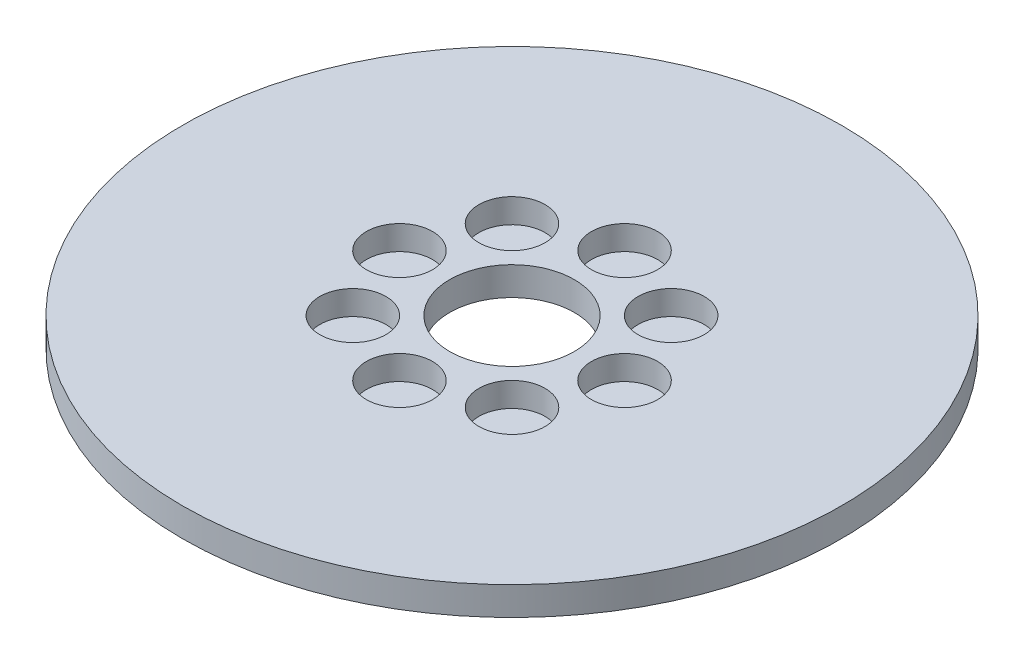
from build123d import *

# Parameters (mm, degrees)
SKETCH1_R           = 92.5
BOSS_EXTRUDE1_DEPTH = 8
SKETCH2_R           = 17.5
CUT_EXTRUDE1_DEPTH  = 132.059146953
SKETCH3_R           = 9.289288959
CUT_EXTRUDE2_DEPTH  = 6.823425341
CIRPATTERN1_COUNT   = 8


with BuildPart() as part:
    # Sketch1 → Boss-Extrude1 (new body)
    with BuildSketch(Plane(origin=(0, 0, 0), x_dir=(1, 0, 0), z_dir=(0, 1, 0))):
        Circle(SKETCH1_R)
    extrude(amount=BOSS_EXTRUDE1_DEPTH)

    # Sketch2 → Cut-Extrude1 (cut, through all)
    with BuildSketch(Plane(origin=(0, 0, 0), x_dir=(1, 0, 0), z_dir=(0, 1, 0))):
        Circle(SKETCH2_R)
    extrude(amount=CUT_EXTRUDE1_DEPTH, mode=Mode.SUBTRACT)

    # Sketch3 → Cut-Extrude2 (cut)
    with BuildSketch(Plane(origin=(0, 8, 0), x_dir=(1, 0, 0), z_dir=(0, 1, 0))):
        with Locations((-31.58667417, 0)):
            Circle(SKETCH3_R)
    cut_extrude2 = extrude(amount=-CUT_EXTRUDE2_DEPTH, mode=Mode.SUBTRACT)

    # CirPattern1: Cut-Extrude2 ×8 about axis
    cirpattern1_axis = Axis((0, 0, 0), (0, 1, 0))
    for i in range(1, CIRPATTERN1_COUNT):
        add(cut_extrude2.rotate(cirpattern1_axis, i * 360 / CIRPATTERN1_COUNT), mode=Mode.SUBTRACT)


solid = part.part
